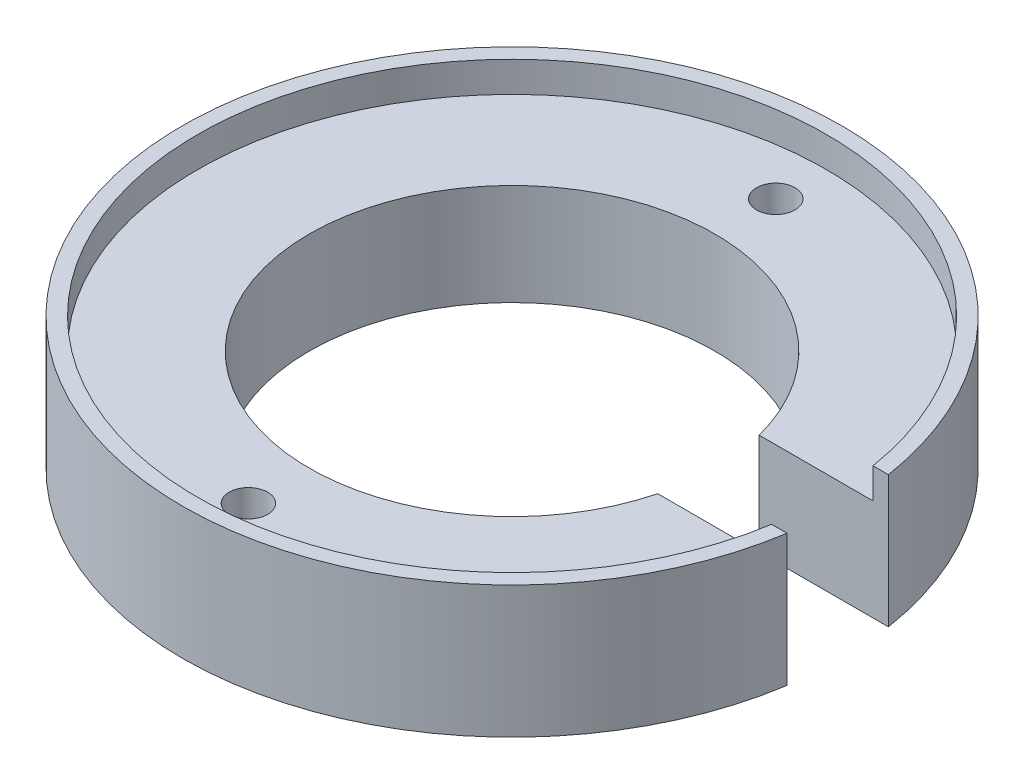
from build123d import *

# Parameters (mm, degrees)
SKETCH1_R                      = 32.5
BOSS_EXTRUDE1_DEPTH            = 10
SKETCH2_R                      = 32.5
SKETCH2_R_2                    = 31
BOSS_EXTRUDE2_DEPTH            = 3
CUT_EXTRUDE1_DEPTH             = 3
CUT_EXTRUDE1_DEPTH_BACK        = 48.037219306
SKETCH3_W                      = 39.818487818
SKETCH3_H                      = 10
FILLET1_R                      = 5
F_3_8_3_8_DIAMETER_HOLE1_D     = 3.8
F_3_8_3_8_DIAMETER_HOLE1_DEPTH = 10
F_3_8_3_8_DIAMETER_HOLE1_TIP   = 1.141635176
SKETCH6_R                      = 20
CUT_EXTRUDE2_DEPTH             = 10


with BuildPart() as part:
    # Sketch1 → Boss-Extrude1 (new body)
    with BuildSketch(Plane(origin=(0, 0, 0), x_dir=(1, 0, 0), z_dir=(0, 1, 0))):
        with Locations(Location((0, 0, 0), (0, 0, 270))):
            Circle(SKETCH1_R)
    extrude(amount=BOSS_EXTRUDE1_DEPTH)

    # Sketch2 → Boss-Extrude2 (add)
    with BuildSketch(Plane(origin=(0, 10, 0), x_dir=(1, 0, 0), z_dir=(0, 1, 0))):
        with Locations(Location((0, 0, 0), (0, 0, 270))):
            Circle(SKETCH2_R)
        with Locations(Location((0, 0, 0), (0, 0, 270))):
            Circle(SKETCH2_R_2, mode=Mode.SUBTRACT)
    extrude(amount=BOSS_EXTRUDE2_DEPTH)

    # Sketch3 → Cut-Extrude1 (cut, two sides: drawn at the far end of the back side and taken through both)
    with BuildSketch(Plane(origin=(0, 10, 0), x_dir=(1, 0, 0), z_dir=(0, 1, 0)).offset(-CUT_EXTRUDE1_DEPTH_BACK)):
        with Locations((19.909243909, 0)):
            Rectangle(SKETCH3_W, SKETCH3_H)
    extrude(amount=CUT_EXTRUDE1_DEPTH + CUT_EXTRUDE1_DEPTH_BACK, mode=Mode.SUBTRACT)

    # Fillet1
    fillet1_edges = [part.edges().sort_by_distance(p)[0] for p in [
        (0, 5, 5),
        (0, 5, -5),
    ]]
    fillet(fillet1_edges, radius=FILLET1_R - 0.0001)  # a hair under: the kernel refuses the full size

    # Ø3.8 (3.8) Diameter Hole1
    with Locations(Plane(origin=(0, 10, 0), x_dir=(1, 0, 0), z_dir=(0, 1, 0))):
        with Locations((0, 26), (0, -26)):
            Hole(F_3_8_3_8_DIAMETER_HOLE1_D / 2, depth=F_3_8_3_8_DIAMETER_HOLE1_DEPTH)
            with Locations((0, 0, -(F_3_8_3_8_DIAMETER_HOLE1_DEPTH + F_3_8_3_8_DIAMETER_HOLE1_TIP / 2))):  # 118° drill point
                Cone(0, F_3_8_3_8_DIAMETER_HOLE1_D / 2, F_3_8_3_8_DIAMETER_HOLE1_TIP, mode=Mode.SUBTRACT)

    # Sketch6 → Cut-Extrude2 (cut)
    with BuildSketch(Plane(origin=(0, 10, 0), x_dir=(1, 0, 0), z_dir=(0, 1, 0))):
        Circle(SKETCH6_R)
    extrude(amount=-CUT_EXTRUDE2_DEPTH, mode=Mode.SUBTRACT)


solid = part.part
